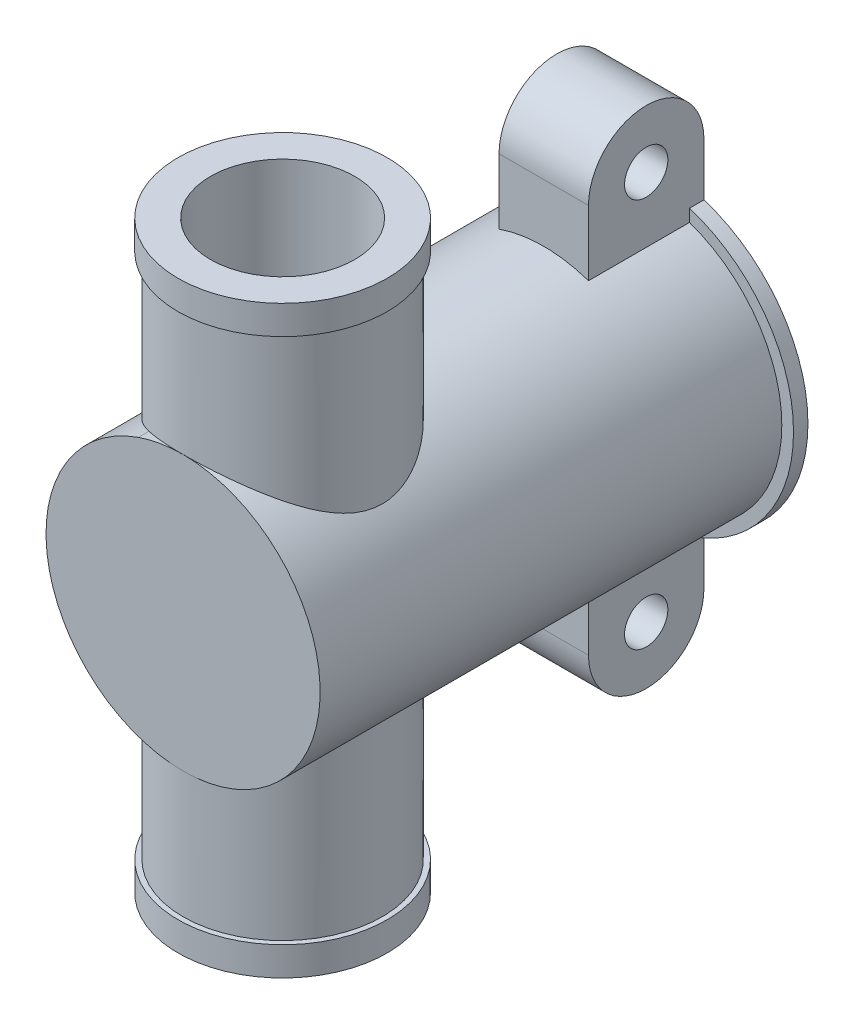
from build123d import *

# Parameters (mm, degrees)
SKETCH1_R                = 9.5
BOSS_EXTRUDE1_DEPTH      = 33
BOSS_EXTRUDE2_REACH      = 55.88
BOSS_EXTRUDE2_END_RADIUS = 9.5
BOSS_EXTRUDE2_START      = 18.25
SKETCH4_R                = 6.9
SKETCH5_R                = 6.9
BOSS_EXTRUDE4_DEPTH      = 18.25
SKETCH7_R                = 8
CUT_EXTRUDE1_DEPTH       = 28.25
SKETCH8_R                = 7.25
BOSS_EXTRUDE5_DEPTH      = 2
BOSS_EXTRUDE6_START      = 2
SKETCH9_R                = 7.25
BOSS_EXTRUDE6_DEPTH      = 2
SKETCH10_R               = 5
CUT_EXTRUDE3_DEPTH       = 10
CUT_EXTRUDE4_START       = -10
SKETCH11_R               = 5
CUT_EXTRUDE4_DEPTH       = 10
SKETCH14_R               = 1.5
BOSS_EXTRUDE7_DEPTH      = 3.1
SKETCH15_R               = 8
CUT_EXTRUDE5_DEPTH       = 16.2
SKETCH16_R               = 10.311237543
BOSS_EXTRUDE8_DEPTH      = 1
SKETCH17_R               = 8
CUT_EXTRUDE6_DEPTH       = 18


with BuildPart() as part:
    # Sketch1 → Boss-Extrude1 (new body)
    with BuildSketch(Plane.XY):
        Circle(SKETCH1_R)
    extrude(amount=BOSS_EXTRUDE1_DEPTH)

    # Boss-Extrude2: up to this cylinder (the profile starts outside it)
    boss_extrude2_end = Plane(origin=(0, 0, 26.1), z_dir=(0, 0, -1)) * Cylinder(BOSS_EXTRUDE2_END_RADIUS, 131.76, mode=Mode.PRIVATE)
    # Sketch4 → Boss-Extrude2 (add, up to the surface)
    with BuildSketch(Plane(origin=(0, 0, 0), x_dir=(1, 0, 0), z_dir=(0, 1, 0)).offset(BOSS_EXTRUDE2_START), mode=Mode.PRIVATE) as boss_extrude2_sk1:
        with Locations((0, -26.1)):
            Circle(SKETCH4_R)
    boss_extrude2_tool1 = extrude(boss_extrude2_sk1.sketch, amount=-BOSS_EXTRUDE2_REACH, mode=Mode.PRIVATE) - boss_extrude2_end
    add(boss_extrude2_tool1.solids().sort_by_distance((0, 18.25, 26.1))[0])

    # Sketch5 → Boss-Extrude4 (add)
    with BuildSketch(Plane(origin=(0, 0, 0), x_dir=(1, 0, 0), z_dir=(0, 1, 0))):
        with Locations((0, -26.1)):
            Circle(SKETCH5_R)
    extrude(amount=-BOSS_EXTRUDE4_DEPTH)

    # Sketch7 → Cut-Extrude1 (cut)
    with BuildSketch(Plane(origin=(0, 0, 0), x_dir=(-1, 0, 0), z_dir=(0, 0, -1))):
        Circle(SKETCH7_R)
    extrude(amount=-CUT_EXTRUDE1_DEPTH, mode=Mode.SUBTRACT)

    # Sketch8 → Boss-Extrude5 (add)
    with BuildSketch(Plane.XZ.offset(18.25)):
        with Locations((0, 26.1)):
            Circle(SKETCH8_R)
    extrude(amount=BOSS_EXTRUDE5_DEPTH)

    # Sketch9 → Boss-Extrude6 (add)
    with BuildSketch(Plane(origin=(0, 18.25, 0), x_dir=(1, 0, 0), z_dir=(0, 1, 0)).offset(BOSS_EXTRUDE6_START)):
        with Locations((0, -26.1)):
            Circle(SKETCH9_R)
    extrude(amount=-BOSS_EXTRUDE6_DEPTH)

    # Sketch10 → Cut-Extrude3 (cut)
    with BuildSketch(Plane.XZ.offset(20.25)):
        with Locations((0, 26.1)):
            Circle(SKETCH10_R)
    extrude(amount=-CUT_EXTRUDE3_DEPTH, mode=Mode.SUBTRACT)

    # Sketch11 → Cut-Extrude4 (cut)
    with BuildSketch(Plane(origin=(0, 20.25, 0), x_dir=(1, 0, 0), z_dir=(0, 1, 0)).offset(CUT_EXTRUDE4_START)):
        with Locations((0, -26.1)):
            Circle(SKETCH11_R)
    extrude(amount=CUT_EXTRUDE4_DEPTH, mode=Mode.SUBTRACT)

    # Sketch14 → Boss-Extrude7 (add, symmetric)
    with BuildSketch(Plane(origin=(0, 0, 0), x_dir=(0, 0, -1), z_dir=(1, 0, 0))):
        with BuildLine():
            Line((-8, 13.5), (-8, -13.5))
            ThreePointArc((-8, -13.5), (-4, -17.5), (0, -13.5))
            Line((0, -13.5), (0, 13.5))
            ThreePointArc((0, 13.5), (-4, 17.5), (-8, 13.5))
        make_face()
        with Locations((-4, -13.5)):
            Circle(SKETCH14_R, mode=Mode.SUBTRACT)
        with Locations((-4, 13.5)):
            Circle(SKETCH14_R, mode=Mode.SUBTRACT)
    extrude(amount=BOSS_EXTRUDE7_DEPTH, both=True)

    # Sketch15 → Cut-Extrude5 (cut)
    with BuildSketch(Plane(origin=(0, 0, 0), x_dir=(-1, 0, 0), z_dir=(0, 0, -1))):
        Circle(SKETCH15_R)
    extrude(amount=-CUT_EXTRUDE5_DEPTH, mode=Mode.SUBTRACT)

    # Sketch16 → Boss-Extrude8 (add)
    with BuildSketch(Plane(origin=(0, 0, 0), x_dir=(-1, 0, 0), z_dir=(0, 0, -1))):
        Circle(SKETCH16_R)
    extrude(amount=-BOSS_EXTRUDE8_DEPTH)

    # Sketch17 → Cut-Extrude6 (cut)
    with BuildSketch(Plane(origin=(0, 0, 0), x_dir=(-1, 0, 0), z_dir=(0, 0, -1))):
        Circle(SKETCH17_R)
    extrude(amount=-CUT_EXTRUDE6_DEPTH, mode=Mode.SUBTRACT)


solid = part.part
